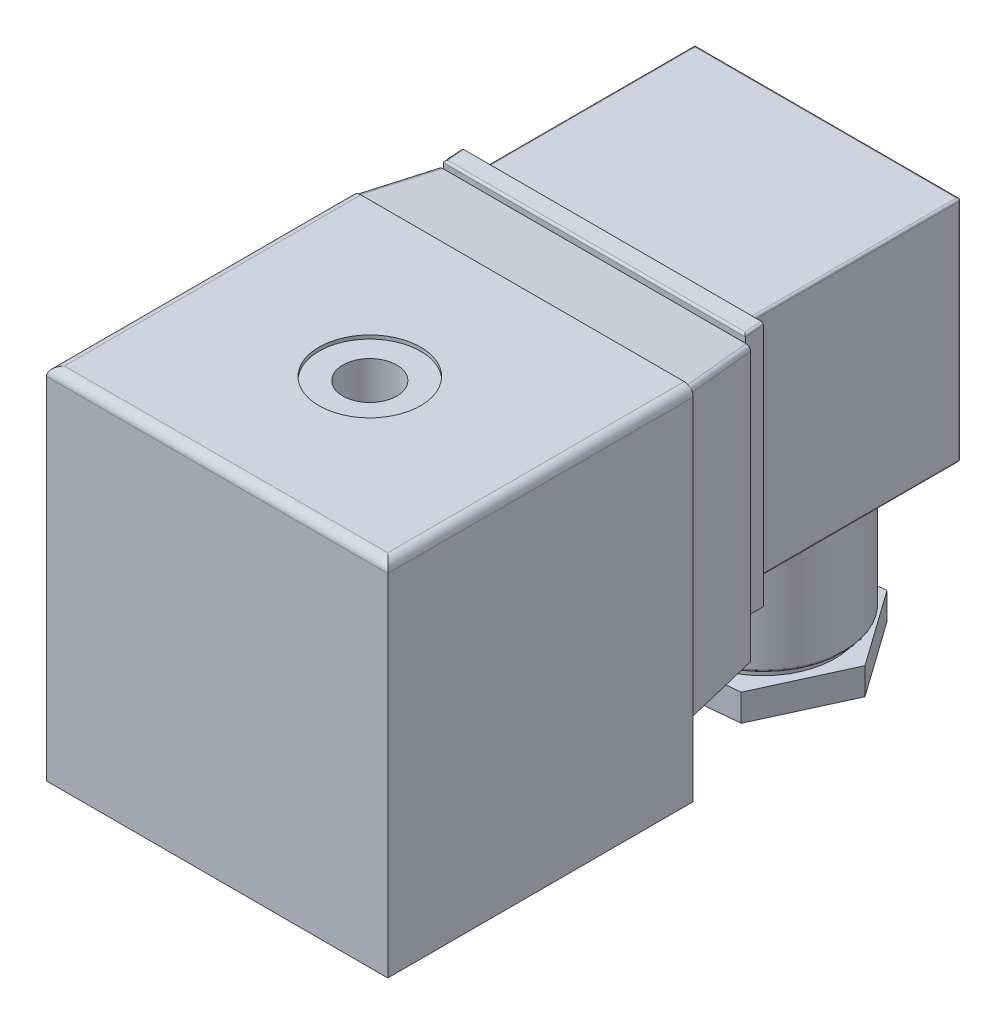
from build123d import *
from OCP.BRepFilletAPI import BRepFilletAPI_MakeChamfer

# Parameters (mm, degrees)
SKETCH2_W                   = 48.26
SKETCH2_H                   = 50.8
BOSS_EXTRUDE1_DEPTH         = 43.18
FILLET1_R                   = 1.27
BOSS_EXTRUDE2_DEPTH         = 10.16
CHAMFER1_SIZE               = 10.16
CHAMFER1_SIZE_2             = 0.888884821
SKETCH4_R                   = 7.183192936
CUT_EXTRUDE1_DEPTH          = 0.508
CHAMFER4_SIZE               = 1.791482124
CHAMFER4_SIZE_2             = 10.16
SKETCH6_W                   = 42.672
SKETCH6_H                   = 34.798230358
BOSS_EXTRUDE3_DEPTH         = 2.54
CHAMFER2_SIZE2              = 2.54
CHAMFER2_SIZE               = 0.222221205
FILLET4_R                   = 0.3175
SKETCH8_W                   = 37.592
SKETCH8_H                   = 32.258230358
BOSS_EXTRUDE4_DEPTH         = 30.48
FILLET5_R                   = 0.3175
FILLET6_R                   = 0.3175
FILLET7_R                   = 0.3175
SKETCH10_R                  = 11.43
BOSS_EXTRUDE5_DEPTH         = 19.05
SKETCH11_R                  = 10.16
BOSS_EXTRUDE6_DEPTH         = 1.27
BOSS_EXTRUDE7_DEPTH         = 3.81
FILLET8_R                   = 0.3175
FILLET2_R                   = 0.635
F_3_64_0_3_DIAMETER_HOLE1_D = 7.62


# Some blends are built 0.0001 mm under size
with BuildPart() as part:
    # Sketch2 → Boss-Extrude1 (new body)
    with BuildSketch(Plane.XY):
        with Locations((24.13, 25.4)):
            Rectangle(SKETCH2_W, SKETCH2_H)
    extrude(amount=BOSS_EXTRUDE1_DEPTH)

    # Fillet1
    fillet1_edges = [part.edges().sort_by_distance(p)[0] for p in [
        (24.13, 50.8, 43.18),
        (0, 50.8, 21.59),
        (48.26, 50.8, 21.59),
    ]]
    fillet(fillet1_edges, radius=FILLET1_R)

    # Sketch3 → Boss-Extrude2 (add)
    with BuildSketch(Plane(origin=(0, 0, 0), x_dir=(-1, 0, 0), z_dir=(0, 0, -1))):
        Polygon((-45.466, 50.546), (-2.794, 50.546), (-0.254, 50.546), (-0.254, 48.006), (-0.254, 10.16), (-48.006, 10.16), (-48.006, 48.006), (-48.006, 50.546), align=None)
    extrude(amount=BOSS_EXTRUDE2_DEPTH)

    # Chamfer1
    chamfer1_edges_1 = [part.edges().sort_by_distance(p)[0] for p in [
        (24.13, 50.546, -10.16),
    ]]
    chamfer1_side_1 = [part.faces().sort_by_distance(p)[0] for p in [
        (24.13, 50.546, -10.142222304),
    ]]
    chamfer1_edges_2 = [part.edges().sort_by_distance(p)[0] for p in [
        (24.13, 10.16, -10.16),
    ]]
    chamfer1_side_2 = [part.faces().sort_by_distance(p)[0] for p in [
        (24.13, 10.16, -10.142222304),
    ]]
    chamfer1 = BRepFilletAPI_MakeChamfer(part.part.solid().wrapped)
    for e in chamfer1_edges_1:
        chamfer1.Add(CHAMFER1_SIZE - 0.0001, CHAMFER1_SIZE_2 - 0.0001, e.wrapped, chamfer1_side_1[0].wrapped)
    for e in chamfer1_edges_2:
        chamfer1.Add(CHAMFER1_SIZE - 0.0001, CHAMFER1_SIZE_2 - 0.0001, e.wrapped, chamfer1_side_2[0].wrapped)
    add(Compound.cast(chamfer1.Shape()), mode=Mode.REPLACE)  # a hair under: the kernel refuses the full size

    # Sketch4 → Cut-Extrude1 (cut)
    with BuildSketch(Plane(origin=(0, 50.8, 0), x_dir=(1, 0, 0), z_dir=(0, 1, 0))):
        with Locations(Location((24.13, -21.59, 0), (0, 0, 270))):
            Circle(SKETCH4_R)
    extrude(amount=-CUT_EXTRUDE1_DEPTH, mode=Mode.SUBTRACT)

    # Chamfer4
    chamfer4_edges_1 = [part.edges().sort_by_distance(p)[0] for p in [
        (48.006, 30.353, -10.16),
    ]]
    chamfer4_side_1 = [part.faces().sort_by_distance(p)[0] for p in [
        (47.970170358, 30.353, -10.16),
    ]]
    chamfer4_edges_2 = [part.edges().sort_by_distance(p)[0] for p in [
        (0.254, 30.353, -10.16),
    ]]
    chamfer4_side_2 = [part.faces().sort_by_distance(p)[0] for p in [
        (0.254, 30.353, -10.124170358),
    ]]
    chamfer4 = BRepFilletAPI_MakeChamfer(part.part.solid().wrapped)
    for e in chamfer4_edges_1:
        chamfer4.Add(CHAMFER4_SIZE - 0.0001, CHAMFER4_SIZE_2 - 0.0001, e.wrapped, chamfer4_side_1[0].wrapped)
    for e in chamfer4_edges_2:
        chamfer4.Add(CHAMFER4_SIZE_2 - 0.0001, CHAMFER4_SIZE - 0.0001, e.wrapped, chamfer4_side_2[0].wrapped)
    add(Compound.cast(chamfer4.Shape()), mode=Mode.REPLACE)  # a hair under: the kernel refuses the full size

    # Sketch6 → Boss-Extrude3 (add)
    with BuildSketch(Plane(origin=(0, 0, -10.16), x_dir=(-1, 0, 0), z_dir=(0, 0, -1))):
        with Locations((-24.13, 33.528)):
            Rectangle(SKETCH6_W, SKETCH6_H)
    extrude(amount=BOSS_EXTRUDE3_DEPTH)

    # Chamfer2
    chamfer2_edges = [part.edges().sort_by_distance(p)[0] for p in [
        (24.13, 50.927115179, -10.16),
    ]]
    chamfer2_side = [part.faces().sort_by_distance(p)[0] for p in [
        (24.13, 50.922670754, -10.16),
    ]]
    chamfer(chamfer2_edges, length=CHAMFER2_SIZE - 0.0001, length2=CHAMFER2_SIZE2 - 0.0001, reference=chamfer2_side[0])  # a hair under: the kernel refuses the full size

    # Fillet4
    # the kernel refuses this fillet: 0.3175 mm, written as the material it takes off along each edge
    with BuildSketch(Plane(origin=(45.466, 50.635842296, -9.369267992), x_dir=(-1, 0, 0), z_dir=(0, 0.08712022396653547, -0.9961978049443899)), Plane(origin=(2.794, 50.635842296, -9.369267992), x_dir=(0, -0.9961978049443899, -0.08712022396653547), z_dir=(0, 0.08712022396653547, -0.9961978049443899))) as fillet4_piece_1:
        with BuildLine():
            CenterArc((FILLET4_R, -FILLET4_R), FILLET4_R, 90, 90)
            Line((0, -FILLET4_R), (0, 0))
            Line((0, 0), (FILLET4_R, 0))
        make_face()
    extrude(amount=4.137094054, mode=Mode.SUBTRACT)
    with BuildSketch(Plane(origin=(46.193363902, 50.704993974, -10.16), x_dir=(0, -1, 0), z_dir=(-1, 0, 0))) as fillet4_piece_2:
        with BuildLine():
            CenterArc((FILLET4_R * 0.916363970592, -FILLET4_R), FILLET4_R, 90, 85.002042847)
            Line((-FILLET4_R * 0.0798338343528, -FILLET4_R * 0.912879776033), (0, 0))
            Line((0, 0), (FILLET4_R * 0.916363970592, 0))
        make_face()
    extrude(amount=44.126727803, mode=Mode.SUBTRACT)

    # Sketch8 → Boss-Extrude4 (add)
    with BuildSketch(Plane(origin=(0, 0, -12.7), x_dir=(-1, 0, 0), z_dir=(0, 0, -1))):
        with Locations((-24.13, 33.528)):
            Rectangle(SKETCH8_W, SKETCH8_H)
    extrude(amount=BOSS_EXTRUDE4_DEPTH)

    # Fillet5
    fillet5_edges = [part.edges().sort_by_distance(p)[0] for p in [
        (42.926, 49.657115179, -27.94),
        (5.334, 49.657115179, -27.94),
        (24.13, 49.657115179, -43.18),
    ]]
    fillet(fillet5_edges, radius=FILLET5_R)

    # Fillet6
    # the kernel refuses this fillet: 0.3175 mm, written as the material it takes off along each edge
    with BuildSketch(Plane(origin=(42.6085, 17.716384821, -42.8625), x_dir=(0, -1, 0), z_dir=(1, 0, 0))) as fillet6_piece_1_section:
        Polygon((0, 0), (FILLET6_R * 1.02, 0), (FILLET6_R * 1.02, FILLET6_R * 1.02), (0, FILLET6_R * 1.02), align=None)
    fillet6_piece_1 = extrude(amount=FILLET6_R * 1.02, mode=Mode.PRIVATE)
    fillet6_piece_1 = fillet6_piece_1 - Plane(origin=(42.6085, 17.716384821, -42.8625), x_dir=(0, 0.7071067811865475, 0.7071067811865475), z_dir=(1, 0, 0)) * Sphere(FILLET6_R, mode=Mode.PRIVATE)
    add(fillet6_piece_1, mode=Mode.SUBTRACT)
    with BuildSketch(Plane(origin=(42.926, 17.398884821, -12.7), x_dir=(0, 1, 0), z_dir=(0, 0, -1))) as fillet6_piece_2:
        with BuildLine():
            CenterArc((FILLET6_R, -FILLET6_R), FILLET6_R, 90, 90)
            Line((0, -FILLET6_R), (0, 0))
            Line((0, 0), (FILLET6_R, 0))
        make_face()
    extrude(amount=30.1625, mode=Mode.SUBTRACT)
    with BuildSketch(Plane(origin=(4.54025, 17.398884821, -43.18), x_dir=(0, 0, 1), z_dir=(1, 0, 0))) as fillet6_piece_3:
        with BuildLine():
            CenterArc((FILLET6_R, -FILLET6_R), FILLET6_R, 90, 90)
            Line((0, -FILLET6_R), (0, 0))
            Line((0, 0), (FILLET6_R, 0))
        make_face()
    extrude(amount=38.06825, mode=Mode.SUBTRACT)
    with BuildSketch(Plane(origin=(5.334, 50.133365179, -43.18), x_dir=(0, 0, 1), z_dir=(0, -1, 0))) as fillet6_piece_4:
        with BuildLine():
            CenterArc((FILLET6_R, -FILLET6_R), FILLET6_R, 90, 90)
            Line((0, -FILLET6_R), (0, 0))
            Line((0, 0), (FILLET6_R, 0))
        make_face()
    extrude(amount=33.528230357, mode=Mode.SUBTRACT)
    with BuildSketch(Plane(origin=(42.926, 17.716384821, -43.18), x_dir=(0, 0, 1), z_dir=(0, 1, 0))) as fillet6_piece_5:
        with BuildLine():
            CenterArc((FILLET6_R, -FILLET6_R), FILLET6_R, 90, 90)
            Line((0, -FILLET6_R), (0, 0))
            Line((0, 0), (FILLET6_R, 0))
        make_face()
    extrude(amount=32.416980357, mode=Mode.SUBTRACT)

    # Fillet7
    # the kernel refuses this fillet: 0.3175 mm, written as the material it takes off along each edge
    with BuildSketch(Plane(origin=(5.6515, 17.716384821, -42.8625), x_dir=(-1, 0, 0), z_dir=(0, -1, 0))) as fillet7_piece_1_section:
        Polygon((0, 0), (FILLET7_R, 0), (FILLET7_R, FILLET7_R), (0, FILLET7_R), align=None)
    fillet7_piece_1 = extrude(amount=FILLET7_R, mode=Mode.PRIVATE)
    fillet7_piece_1 = fillet7_piece_1 - Plane(origin=(5.6515, 17.716384821, -42.8625), x_dir=(0.7071067811865475, 0, 0.7071067811865475), z_dir=(0, -1, 0)) * Sphere(FILLET7_R, mode=Mode.PRIVATE)
    add(fillet7_piece_1, mode=Mode.SUBTRACT)
    with BuildSketch(Plane(origin=(5.334, 17.398884821, -12.7), x_dir=(1, 0, 0), z_dir=(0, 0, -1))) as fillet7_piece_2:
        with BuildLine():
            CenterArc((FILLET7_R, -FILLET7_R), FILLET7_R, 90, 90)
            Line((0, -FILLET7_R), (0, 0))
            Line((0, 0), (FILLET7_R, 0))
        make_face()
    extrude(amount=30.1625, mode=Mode.SUBTRACT)

    # Sketch10 → Boss-Extrude5 (add)
    with BuildSketch(Plane.XZ.offset(-17.398884821)):
        with Locations(Location((27.686, -30.48, 0), (0, 0, 90))):
            Circle(SKETCH10_R)
    extrude(amount=BOSS_EXTRUDE5_DEPTH)

    # Sketch11 → Boss-Extrude6 (add)
    with BuildSketch(Plane.XZ.offset(1.651115179)):
        with Locations(Location((27.686, -30.48, 0), (0, 0, 270))):
            Circle(SKETCH11_R)
    extrude(amount=BOSS_EXTRUDE6_DEPTH)

    # Sketch12 → Boss-Extrude7 (add)
    with BuildSketch(Plane.XZ.offset(2.921115179)):
        Polygon((33.181274645, -42.479798189), (40.825767394, -31.720851652), (35.33049275, -19.721053462), (22.190725355, -18.480201811), (14.546232606, -29.239148348), (20.04150725, -41.238946538), align=None)
    extrude(amount=BOSS_EXTRUDE7_DEPTH)

    # Fillet8
    fillet8_edges = [part.edges().sort_by_distance(p)[0] for p in [
        (27.686, -1.651115179, -41.91),
    ]]
    fillet(fillet8_edges, radius=FILLET8_R)

    # Fillet2
    # the kernel refuses this fillet: 0.635 mm, written as the material it takes off along each edge
    with BuildSketch(Plane(origin=(45.944105867, 49.523002068, -11.694220381), x_dir=(0.01490405395374314, -0.9963095509323676, 0.08452897666887954), z_dir=(0.17299962328390456, 0.08583285338927087, 0.9811747304240377))) as fillet2_piece_1_section:
        with BuildLine():
            CenterArc((FILLET2_R * 0.984980559667, -FILLET2_R), FILLET2_R, 90, 89.132954612)
            Line((-FILLET2_R * 0.0149049417488, -FILLET2_R * 0.984867780788), (0, 0))
            Line((0, 0), (FILLET2_R * 0.984980559667, 0))
        make_face()
    fillet2_piece_1 = extrude(amount=13.48214579, mode=Mode.PRIVATE)
    fillet2_piece_1 = split(fillet2_piece_1, bisect_by=Plane(origin=(46.959597239, 49.956662585, -10.16), z_dir=(0, 0, 1)), keep=Keep.TOP, mode=Mode.PRIVATE)
    fillet2_piece_1 = split(fillet2_piece_1, bisect_by=Plane(origin=(46.959597239, 49.956662585, 0), z_dir=(0, 0, -1)), keep=Keep.TOP, mode=Mode.PRIVATE)
    add(fillet2_piece_1, mode=Mode.SUBTRACT)
    with BuildSketch(Plane(origin=(-0.016512009, 50.680213111, 1.534120381), x_dir=(-0.014904053953745064, -0.9963095509323676, 0.0845289766688792), z_dir=(0.17299962328390434, -0.08583285338927088, -0.9811747304240378))) as fillet2_piece_2_section:
        with BuildLine():
            CenterArc((FILLET2_R * 0.984980559667, -FILLET2_R), FILLET2_R, 90, 89.132954612)
            Line((-FILLET2_R * 0.0149049417488, -FILLET2_R * 0.984867780788), (0, 0))
            Line((0, 0), (FILLET2_R * 0.984980559667, 0))
        make_face()
    fillet2_piece_2 = extrude(amount=13.48214579, mode=Mode.PRIVATE)
    fillet2_piece_2 = split(fillet2_piece_2, bisect_by=Plane(origin=(0.354174002, 50.466816982, -10.16), z_dir=(0, 0, 1)), keep=Keep.TOP, mode=Mode.PRIVATE)
    fillet2_piece_2 = split(fillet2_piece_2, bisect_by=Plane(origin=(0.354174002, 50.466816982, 0), z_dir=(0, 0, -1)), keep=Keep.TOP, mode=Mode.PRIVATE)
    add(fillet2_piece_2, mode=Mode.SUBTRACT)

    # 3/64 (0.3) Diameter Hole1 (through all)
    with Locations(Plane(origin=(0, 50.292, 0), x_dir=(1, 0, 0), z_dir=(0, 1, 0))):
        with Locations((24.13, -21.59)):
            Hole(F_3_64_0_3_DIAMETER_HOLE1_D / 2)


solid = part.part
